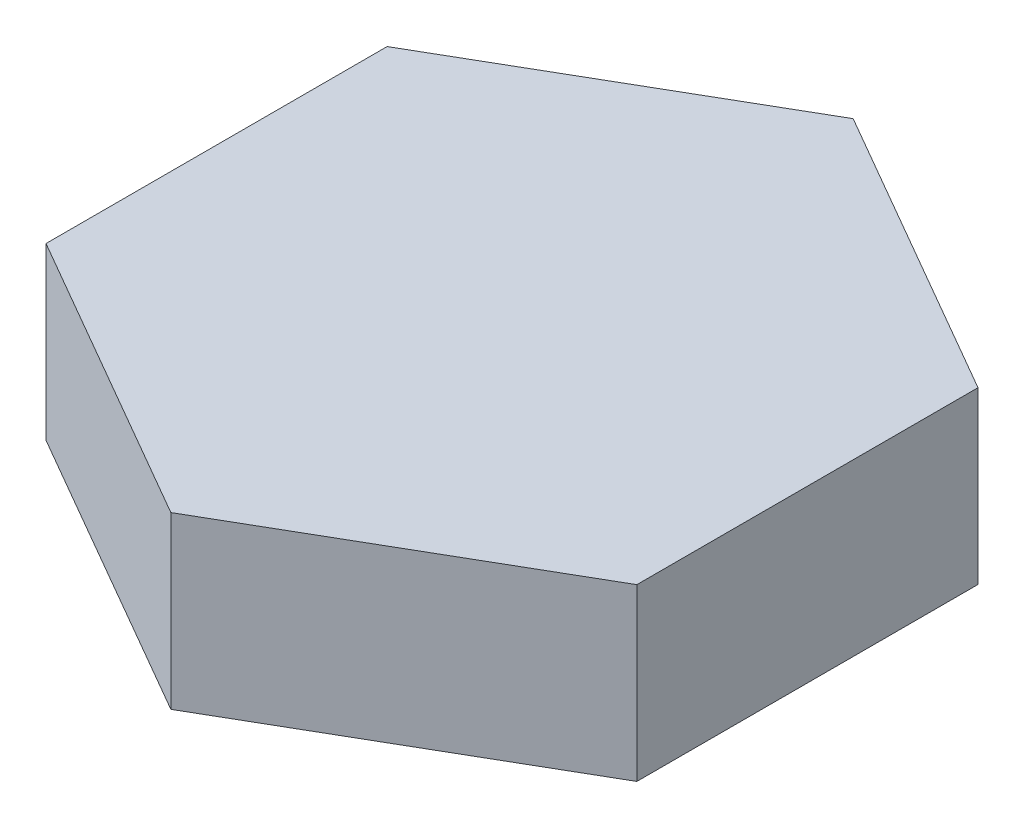
from build123d import *

# Parameters (mm, degrees)
BOSS_EXTRUDE1_DEPTH = 135


with BuildPart() as part:
    # TopPlaneBase → Boss-Extrude1 (new body)
    with BuildSketch(Plane(origin=(0, 0, 0), x_dir=(1, 0, 0), z_dir=(0, 1, 0))):
        Polygon((0, 270.199925981), (-234, 135.09996299), (-234, -135.09996299), (0, -270.199925981), (234, -135.09996299), (234, 135.09996299), align=None)
    extrude(amount=BOSS_EXTRUDE1_DEPTH)


solid = part.part
